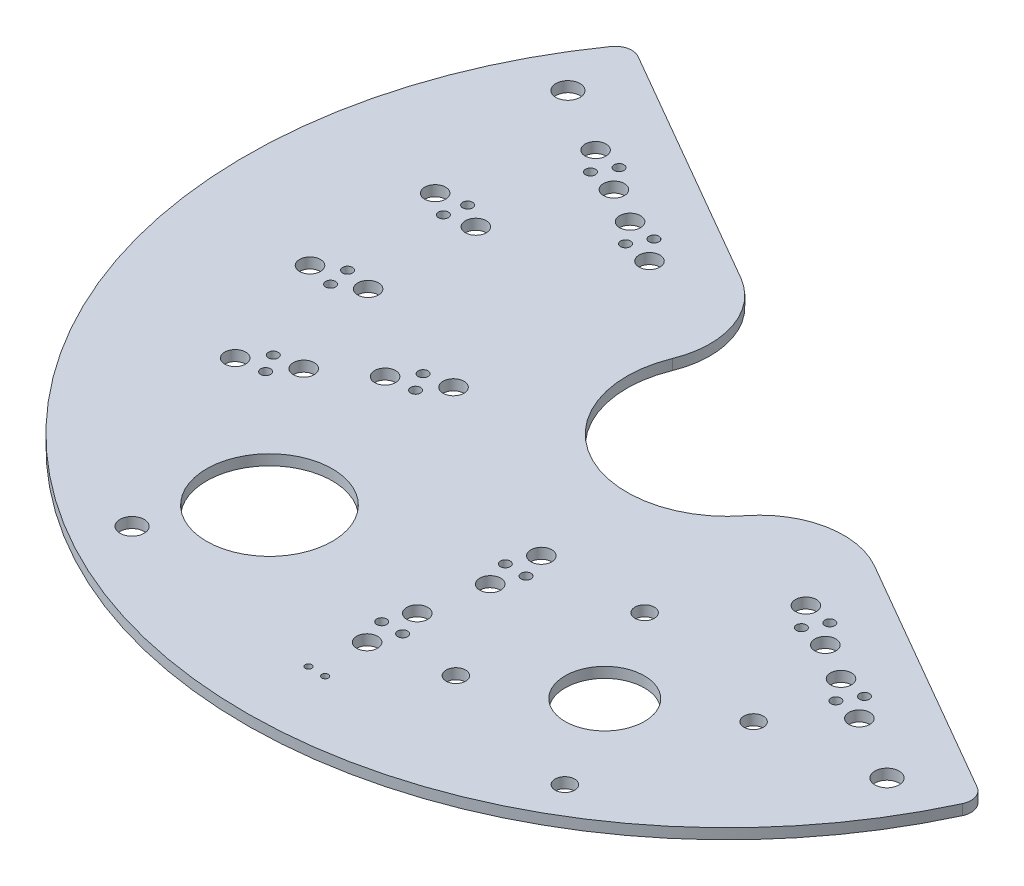
from build123d import *

# Parameters (mm, degrees)
SKETCH1_R           = 73.025
SKETCH1_R_2         = 15.24
SKETCH1_R_3         = 0.75
SKETCH1_R_4         = 1.585
SKETCH1_R_5         = 20
SKETCH1_R_6         = 9.525
SKETCH1_R_7         = 6
BOSS_EXTRUDE1_DEPTH = 1.5875
SKETCH2_R           = 1.8288
CUT_EXTRUDE1_DEPTH  = 104.285146107
CUT_EXTRUDE2_DEPTH  = 104.285146107
FILLET1_R           = 12.7
FILLET2_R           = 2.54
SKETCH4_R           = 0.4953
CUT_EXTRUDE3_DEPTH  = 104.285146107
SKETCH5_R           = 0.4953
SKETCH5_R_2         = 0.75
BOSS_EXTRUDE2_DEPTH = 0.1016
SKETCH6_R           = 1.4732
CUT_EXTRUDE4_DEPTH  = 104.285146107


with BuildPart() as part:
    # Sketch1 → Boss-Extrude1 (new body)
    with BuildSketch(Plane(origin=(0, 0, 0), x_dir=(1, 0, 0), z_dir=(0, 1, 0))):
        Circle(SKETCH1_R)
        Circle(SKETCH1_R_2, mode=Mode.SUBTRACT)
        with Locations((-1.585, 50.8)):
            Circle(SKETCH1_R_3, mode=Mode.SUBTRACT)
        with Locations((1.585, 50.8)):
            Circle(SKETCH1_R_3, mode=Mode.SUBTRACT)
        with Locations((0, 54.6)):
            Circle(SKETCH1_R_4, mode=Mode.SUBTRACT)
        with Locations((0, 47)):
            Circle(SKETCH1_R_4, mode=Mode.SUBTRACT)
        with Locations((47.284987047, 27.3)):
            Circle(SKETCH1_R_4, mode=Mode.SUBTRACT)
        with Locations((43.201590512, 26.772650265)):
            Circle(SKETCH1_R_3, mode=Mode.SUBTRACT)
        with Locations((44.786590512, 24.027349735)):
            Circle(SKETCH1_R_3, mode=Mode.SUBTRACT)
        with Locations((40.703193978, 23.5)):
            Circle(SKETCH1_R_4, mode=Mode.SUBTRACT)
        with Locations((47.284987047, -27.3)):
            Circle(SKETCH1_R_4, mode=Mode.SUBTRACT)
        with Locations((44.786590512, -24.027349735)):
            Circle(SKETCH1_R_3, mode=Mode.SUBTRACT)
        with Locations((43.201590512, -26.772650265)):
            Circle(SKETCH1_R_3, mode=Mode.SUBTRACT)
        with Locations((40.703193978, -23.5)):
            Circle(SKETCH1_R_4, mode=Mode.SUBTRACT)
        with Locations((0, -54.6)):
            Circle(SKETCH1_R_4, mode=Mode.SUBTRACT)
        with Locations((1.585, -50.8)):
            Circle(SKETCH1_R_3, mode=Mode.SUBTRACT)
        with Locations((-1.585, -50.8)):
            Circle(SKETCH1_R_3, mode=Mode.SUBTRACT)
        with Locations((0, -47)):
            Circle(SKETCH1_R_4, mode=Mode.SUBTRACT)
        with Locations((-47.284987047, -27.3)):
            Circle(SKETCH1_R_4, mode=Mode.SUBTRACT)
        with Locations((-43.201590512, -26.772650265)):
            Circle(SKETCH1_R_3, mode=Mode.SUBTRACT)
        with Locations((-44.786590512, -24.027349735)):
            Circle(SKETCH1_R_3, mode=Mode.SUBTRACT)
        with Locations((-40.703193978, -23.5)):
            Circle(SKETCH1_R_4, mode=Mode.SUBTRACT)
        with Locations((-47.284987047, 27.3)):
            Circle(SKETCH1_R_4, mode=Mode.SUBTRACT)
        with Locations((-44.786590512, 24.027349735)):
            Circle(SKETCH1_R_3, mode=Mode.SUBTRACT)
        with Locations((-43.201590512, 26.772650265)):
            Circle(SKETCH1_R_3, mode=Mode.SUBTRACT)
        with Locations((-40.703193978, 23.5)):
            Circle(SKETCH1_R_4, mode=Mode.SUBTRACT)
        with Locations((25.4, 43.994090512)):
            Circle(SKETCH1_R_5, mode=Mode.SUBTRACT)
        with Locations((-25.4, -43.994090512)):
            Circle(SKETCH1_R_6, mode=Mode.SUBTRACT)
        with Locations((25.4, -43.994090512)):
            Circle(SKETCH1_R_7, mode=Mode.SUBTRACT)
        with Locations((-46.285964392, 8.16146435)):
            Circle(SKETCH1_R_4, mode=Mode.SUBTRACT)
        with Locations((-50.303466215, 7.260407137)):
            Circle(SKETCH1_R_3, mode=Mode.SUBTRACT)
        with Locations((-49.753001491, 10.382247714)):
            Circle(SKETCH1_R_3, mode=Mode.SUBTRACT)
        with Locations((-53.770503314, 9.481190501)):
            Circle(SKETCH1_R_4, mode=Mode.SUBTRACT)
        with Locations((-46.285964392, -8.16146435)):
            Circle(SKETCH1_R_4, mode=Mode.SUBTRACT)
        with Locations((-49.753001491, -10.382247714)):
            Circle(SKETCH1_R_3, mode=Mode.SUBTRACT)
        with Locations((-50.303466215, -7.260407137)):
            Circle(SKETCH1_R_3, mode=Mode.SUBTRACT)
        with Locations((-53.770503314, -9.481190501)):
            Circle(SKETCH1_R_4, mode=Mode.SUBTRACT)
        with Locations((-29.397305699, -17.855276467)):
            Circle(SKETCH1_R_3, mode=Mode.SUBTRACT)
        with Locations((-31.002036221, -15.116847022)):
            Circle(SKETCH1_R_3, mode=Mode.SUBTRACT)
        with Locations((-33.503208801, -18.377965576)):
            Circle(SKETCH1_R_4, mode=Mode.SUBTRACT)
        with Locations((-26.914267425, -14.590346807)):
            Circle(SKETCH1_R_4, mode=Mode.SUBTRACT)
        with Locations((0.18310412, -33.841026905)):
            Circle(SKETCH1_R_3, mode=Mode.SUBTRACT)
        with Locations((3.356893615, -33.875899805)):
            Circle(SKETCH1_R_3, mode=Mode.SUBTRACT)
        with Locations((1.849768537, -30.052376234)):
            Circle(SKETCH1_R_4, mode=Mode.SUBTRACT)
        with Locations((1.702835812, -37.650969207)):
            Circle(SKETCH1_R_4, mode=Mode.SUBTRACT)
        with Locations((30.985856532, -19.788486735)):
            Circle(SKETCH1_R_3, mode=Mode.SUBTRACT)
        with Locations((32.50665139, -17.002568775)):
            Circle(SKETCH1_R_3, mode=Mode.SUBTRACT)
        with Locations((28.42312809, -16.538245649)):
            Circle(SKETCH1_R_4, mode=Mode.SUBTRACT)
        with Locations((35.063306729, -20.235302863)):
            Circle(SKETCH1_R_4, mode=Mode.SUBTRACT)
        with Locations((-32.704469206, 17.259289581)):
            Circle(SKETCH1_R_3, mode=Mode.SUBTRACT)
        with Locations((-31.183674349, 20.045207541)):
            Circle(SKETCH1_R_3, mode=Mode.SUBTRACT)
        with Locations((-35.267197648, 20.509530667)):
            Circle(SKETCH1_R_4, mode=Mode.SUBTRACT)
        with Locations((-28.627019009, 16.812473453)):
            Circle(SKETCH1_R_4, mode=Mode.SUBTRACT)
    extrude(amount=-BOSS_EXTRUDE1_DEPTH)

    # Sketch2 → Cut-Extrude1 (cut, through all)
    with BuildSketch(Plane(origin=(0, 0, 0), x_dir=(1, 0, 0), z_dir=(0, 1, 0))):
        with Locations((-57.192317666, 33.02)):
            Circle(SKETCH2_R)
        with Locations((33.02, 57.192317666)):
            Circle(SKETCH2_R)
        with Locations((57.192317666, -33.02)):
            Circle(SKETCH2_R)
        with Locations((-33.02, -57.192317666)):
            Circle(SKETCH2_R)
    extrude(amount=-CUT_EXTRUDE1_DEPTH, mode=Mode.SUBTRACT)

    # Sketch3 → Cut-Extrude2 (cut, through all)
    with BuildSketch(Plane(origin=(0, 0, 0), x_dir=(1, 0, 0), z_dir=(0, 1, 0))):
        with BuildLine():
            Line((-59.533825484, 44.637157955), (68.423825484, -29.239226276))
            ThreePointArc((68.423825484, -29.239226276), (37.204677955, 64.440392498), (-59.533825484, 44.637157955))
        make_face()
    extrude(amount=-CUT_EXTRUDE2_DEPTH, mode=Mode.SUBTRACT)

    # Fillet1
    fillet1_edges = [part.edges().sort_by_distance(p)[0] for p in [
        (15.165033815, -0.79375, -1.509751431),
        (-6.275033815, -0.79375, -13.888180249),
    ]]
    fillet(fillet1_edges, radius=FILLET1_R)

    # Fillet2
    fillet2_edges = [part.edges().sort_by_distance(p)[0] for p in [
        (67.216123088, -0.79375, 28.541958973),
        (-58.326123088, -0.79375, -43.939890652),
    ]]
    fillet(fillet2_edges, radius=FILLET2_R)

    # Sketch4 → Cut-Extrude3 (cut, through all)
    with BuildSketch(Plane(origin=(0, 0, 0), x_dir=(1, 0, 0), z_dir=(0, 1, 0))):
        with Locations((1.27, -62.23)):
            Circle(SKETCH4_R)
        with Locations((-1.27, -62.23)):
            Circle(SKETCH4_R)
    extrude(amount=-CUT_EXTRUDE3_DEPTH, mode=Mode.SUBTRACT)

    # Sketch5 → Boss-Extrude2 (add)
    # profile 1 of 10: a face of its own
    with BuildSketch(Plane.XZ.offset(1.5875)):
        with BuildLine():
            Line((34.490720839, 15.234132112), (45.023794735, 21.301797022))
            ThreePointArc((45.023794735, 21.301797022), (44.640302422, 22.09416322), (44.242866733, 22.879628318))
            ThreePointArc((44.242866733, 22.879628318), (44.194605568, 25.15093944), (46.040660753, 23.82683083))
            ThreePointArc((46.040660753, 23.82683083), (46.421042895, 23.076981746), (46.789213502, 22.321062023))
            Line((46.789213502, 22.321062023), (54.774266163, 26.931234326))
            ThreePointArc((54.774266163, 26.931234326), (32.789239067, 51.481816376), (1.245393112, 61.024262486))
            ThreePointArc((1.245393112, 61.024262486), (0.064262486, 62.254606888), (1.294606888, 63.435737514))
            ThreePointArc((1.294606888, 63.435737514), (34.873073505, 53.006014236), (57.7422016, 26.298421156))
            Line((57.7422016, 26.298421156), (28.012465947, 9.133950273))
            ThreePointArc((28.012465947, 9.133950273), (-12.042501731, 20.858224848), (-21.916465947, -19.692531996))
            Line((-21.916465947, -19.692531996), (-41.53590206, -31.019818717))
            ThreePointArc((-41.53590206, -31.019818717), (-42.622921376, -29.508420604), (-43.654971216, -27.958966385))
            ThreePointArc((-43.654971216, -27.958966385), (-43.878655247, -25.698181398), (-41.935772719, -26.875632368))
            ThreePointArc((-41.935772719, -26.875632368), (-41.454257835, -27.61255432), (-40.959794735, -28.340851504))
            Line((-40.959794735, -28.340851504), (-30.537815121, -22.27790388))
            Line((-30.537815121, -22.27790388), (-31.053590427, -21.385433264))
            ThreePointArc((-31.053590427, -21.385433264), (-31.761936541, -19.017766992), (-30.06523382, -20.814652539))
            Line((-30.06523382, -20.814652539), (-29.551271602, -21.703985881))
            Line((-29.551271602, -21.703985881), (-25.045535575, -19.082790815))
            ThreePointArc((-25.045535575, -19.082790815), (-13.264226318, 23.017060497), (29.071086472, 12.112106614))
            Line((29.071086472, 12.112106614), (33.500885608, 14.663929286))
            ThreePointArc((33.500885608, 14.663929286), (33.174864003, 15.236775822), (32.841290582, 15.805258023))
            ThreePointArc((32.841290582, 15.805258023), (31.60714545, 17.921497395), (33.747259191, 16.729232129))
            ThreePointArc((33.747259191, 16.729232129), (34.125009903, 15.984675603), (34.490720839, 15.234132112))
        make_face()
        with Locations((1.27, 62.23)):
            Circle(SKETCH5_R, mode=Mode.SUBTRACT)
        with Locations((44.786590512, 24.027349735)):
            Circle(SKETCH5_R_2, mode=Mode.SUBTRACT)
        with Locations((-43.201590512, -26.772650265)):
            Circle(SKETCH5_R_2, mode=Mode.SUBTRACT)
    # profile 2 of 10: a face of its own
    with BuildSketch(Plane.XZ.offset(1.5875)):
        with BuildLine():
            Line((33.336492348, 26.169869047), (41.535902035, 31.019818701))
            ThreePointArc((41.535902035, 31.019818701), (42.622921339, 29.508420605), (43.654971168, 27.958966404))
            ThreePointArc((43.654971168, 27.958966404), (43.878655268, 25.698181412), (41.935772719, 26.875632368))
            ThreePointArc((41.935772719, 26.875632368), (41.454257835, 27.61255432), (40.959794735, 28.340851504))
            Line((40.959794735, 28.340851504), (32.479535914, 23.822017232))
            ThreePointArc((32.479535914, 23.822017232), (19.997147631, 34.964594161), (4.064, 40.073590583))
            Line((4.064, 40.073590583), (4.064, 49.642648525))
            ThreePointArc((4.064, 49.642648525), (3.186044586, 49.706717539), (2.307094012, 49.755260685))
            ThreePointArc((2.307094012, 49.755260685), (0.3159503, 50.849120845), (2.385689572, 51.785797245))
            ThreePointArc((2.385689572, 51.785797245), (4.243581194, 51.666742975), (6.095999999, 51.48105569))
            Line((6.095999999, 51.48105569), (6.095999999, 41.940702808))
            ThreePointArc((6.095999999, 41.940702808), (21.234645336, 36.677971665), (33.336492348, 26.169869047))
        make_face()
        with Locations((1.585, 50.8)):
            Circle(SKETCH5_R_2, mode=Mode.SUBTRACT)
        with Locations((43.201590512, 26.772650265)):
            Circle(SKETCH5_R_2, mode=Mode.SUBTRACT)
    # profile 3 of 10: a face of its own
    with BuildSketch(Plane.XZ.offset(1.5875)):
        with BuildLine():
            Line((-6.095999999, 38.638067239), (-6.095999999, 51.481055694))
            ThreePointArc((-6.095999999, 51.481055694), (-4.243581193, 51.666742978), (-2.38568957, 51.785797247))
            ThreePointArc((-2.38568957, 51.785797247), (-0.3159503, 50.849120844), (-2.307094012, 49.755260685))
            ThreePointArc((-2.307094012, 49.755260685), (-3.186044586, 49.706717539), (-4.064, 49.642648525))
            Line((-4.064, 49.642648525), (-4.064, 36.860642425))
            ThreePointArc((-4.064, 36.860642425), (-18.542, 32.115686074), (-29.89025274, 21.949848454))
            Line((-29.89025274, 21.949848454), (-40.959794734, 28.340851504))
            ThreePointArc((-40.959794734, 28.340851504), (-41.454257834, 27.612554318), (-41.935772719, 26.875632366))
            ThreePointArc((-41.935772719, 26.875632366), (-43.878655251, 25.698181402), (-43.654971208, 27.958966388))
            ThreePointArc((-43.654971208, 27.958966388), (-42.622921369, 29.508420604), (-41.535902055, 31.019818714))
            Line((-41.535902055, 31.019818714), (-30.413547783, 24.598324481))
            ThreePointArc((-30.413547783, 24.598324481), (-19.558, 33.875449694), (-6.095999999, 38.638067239))
        make_face()
        with Locations((-1.585, 50.8)):
            Circle(SKETCH5_R_2, mode=Mode.SUBTRACT)
        with Locations((-43.201590512, 26.772650265)):
            Circle(SKETCH5_R_2, mode=Mode.SUBTRACT)
    # profile 4 of 10: a face of its own
    with BuildSketch(Plane.XZ.offset(1.5875)):
        with BuildLine():
            ThreePointArc((-1.137328397, 61.026372169), (-0.059313178, 62.253645904), (-1.184427719, 63.437890349))
            ThreePointArc((-1.184427719, 63.437890349), (-54.638937722, 32.254538991), (-56.114446604, -29.613133627))
            ThreePointArc((-56.114446604, -29.613133627), (-54.535716158, -29.885091506), (-54.048929792, -28.358857598))
            ThreePointArc((-54.048929792, -28.358857598), (-52.52438099, 31.091815927), (-1.137328397, 61.026372169))
        make_face()
        with Locations((-1.27, 62.23)):
            Circle(SKETCH5_R, mode=Mode.SUBTRACT)
    # profile 5 of 10: a face of its own
    with BuildSketch(Plane.XZ.offset(1.5875)):
        with BuildLine():
            ThreePointArc((-48.598743805, -10.911954419), (-50.021744231, -9.141007471), (-50.584784003, -11.341954885))
            ThreePointArc((-50.584784003, -11.341954885), (-48.714342612, -17.730570692), (-46.040660761, -23.826830882))
            ThreePointArc((-46.040660761, -23.826830882), (-44.194605546, -25.150939428), (-44.242866733, -22.879628318))
            ThreePointArc((-44.242866733, -22.879628318), (-46.804887207, -17.035585761), (-48.598743805, -10.911954419))
        make_face()
        with Locations((-49.753001492, -10.382247714)):
            Circle(SKETCH5_R_2, mode=Mode.SUBTRACT)
        with Locations((-44.786590512, -24.027349735)):
            Circle(SKETCH5_R_2, mode=Mode.SUBTRACT)
    # profile 6 of 10: a face of its own
    with BuildSketch(Plane.XZ.offset(1.5875)):
        with BuildLine():
            ThreePointArc((-51.413325287, -6.643063764), (-50.131472618, -8.518706864), (-49.399989147, -6.367866276))
            ThreePointArc((-49.399989147, -6.367866276), (-49.808720609, 0), (-49.399989147, 6.367866277))
            ThreePointArc((-49.399989147, 6.367866277), (-50.131472619, 8.518706864), (-51.413325286, 6.643063762))
            ThreePointArc((-51.413325286, 6.643063762), (-51.840720608, -1e-09), (-51.413325287, -6.643063764))
        make_face()
        with Locations((-50.303466215, 7.260407137)):
            Circle(SKETCH5_R_2, mode=Mode.SUBTRACT)
        with Locations((-50.303466215, -7.260407137)):
            Circle(SKETCH5_R_2, mode=Mode.SUBTRACT)
    # profile 7 of 10: a face of its own
    with BuildSketch(Plane.XZ.offset(1.5875)):
        with BuildLine():
            ThreePointArc((-50.584784, 11.341954887), (-50.021744233, 9.141007472), (-48.598743805, 10.911954418))
            ThreePointArc((-48.598743805, 10.911954418), (-46.804887206, 17.035585761), (-44.242866731, 22.879628319))
            ThreePointArc((-44.242866731, 22.879628319), (-44.194605549, 25.15093943), (-46.04066076, 23.826830875))
            ThreePointArc((-46.04066076, 23.826830875), (-46.866502555, 22.158322389), (-47.631902057, 20.461236993))
            ThreePointArc((-47.631902057, 20.461236993), (-49.319566924, 15.96999159), (-50.584784, 11.341954887))
        make_face()
        with Locations((-44.786590512, 24.027349735)):
            Circle(SKETCH5_R_2, mode=Mode.SUBTRACT)
        with Locations((-49.753001492, 10.382247714)):
            Circle(SKETCH5_R_2, mode=Mode.SUBTRACT)
    # profile 8 of 10: a face of its own
    with BuildSketch(Plane.XZ.offset(1.5875)):
        with BuildLine():
            ThreePointArc((29.750286049, 20.294824353), (31.818786572, 18.884056056), (30.842384069, 21.189614503))
            ThreePointArc((30.842384069, 21.189614503), (19.436792184, 31.341447854), (4.523593019, 34.619211922))
            ThreePointArc((4.523593019, 34.619211922), (2.183689823, 33.970896872), (4.484099362, 33.193995769))
            ThreePointArc((4.484099362, 33.193995769), (18.709722164, 29.863769073), (29.750286049, 20.294824353))
        make_face()
    # profile 9 of 10: a face of its own
    with BuildSketch(Plane.XZ.offset(1.5875)):
        with BuildLine():
            ThreePointArc((-0.892844209, 32.974481926), (1.313564772, 33.515723797), (-0.44322017, 34.956171651))
            ThreePointArc((-0.44322017, 34.956171651), (-16.808276637, 30.222831543), (-29.697033, 19.082834184))
            ThreePointArc((-29.697033, 19.082834184), (-30.254991066, 16.880593019), (-28.158390528, 17.75549275))
            ThreePointArc((-28.158390528, 17.75549275), (-16.302373049, 28.548130039), (-0.892844209, 32.974481926))
        make_face()
    # profile 10 of 10: a face of its own
    with BuildSketch(Plane.XZ.offset(1.5875)):
        with BuildLine():
            ThreePointArc((-31.336769265, 13.038282839), (-30.328093766, 16.217420137), (-32.984953468, 14.201127316))
            ThreePointArc((-32.984953468, 14.201127316), (-33.66330563, 12.920695881), (-34.330413979, 11.634370586))
            ThreePointArc((-34.330413979, 11.634370586), (-37.669342414, -2.643171748), (-33.915331162, -16.817234599))
            ThreePointArc((-33.915331162, -16.817234599), (-32.492330711, -18.588181541), (-31.929291004, -16.3872341))
            ThreePointArc((-31.929291004, -16.3872341), (-32.27952678, -15.643177599), (-32.64152132, -14.904770442))
            ThreePointArc((-32.64152132, -14.904770442), (-35.634138362, -0.763047218), (-31.336769265, 13.038282839))
        make_face()
    extrude(amount=BOSS_EXTRUDE2_DEPTH)

    # Sketch6 → Cut-Extrude4 (cut, through all)
    with BuildSketch(Plane.XZ.offset(1.5875)):
        with Locations((33.655, 58.292169929)):
            Circle(SKETCH6_R)
        with Locations((11.101920584, 52.249090512)):
            Circle(SKETCH6_R)
        with Locations((17.145, 29.696011096)):
            Circle(SKETCH6_R)
        with Locations((39.698079417, 35.739090512)):
            Circle(SKETCH6_R)
    extrude(amount=-CUT_EXTRUDE4_DEPTH, mode=Mode.SUBTRACT)


solid = part.part
